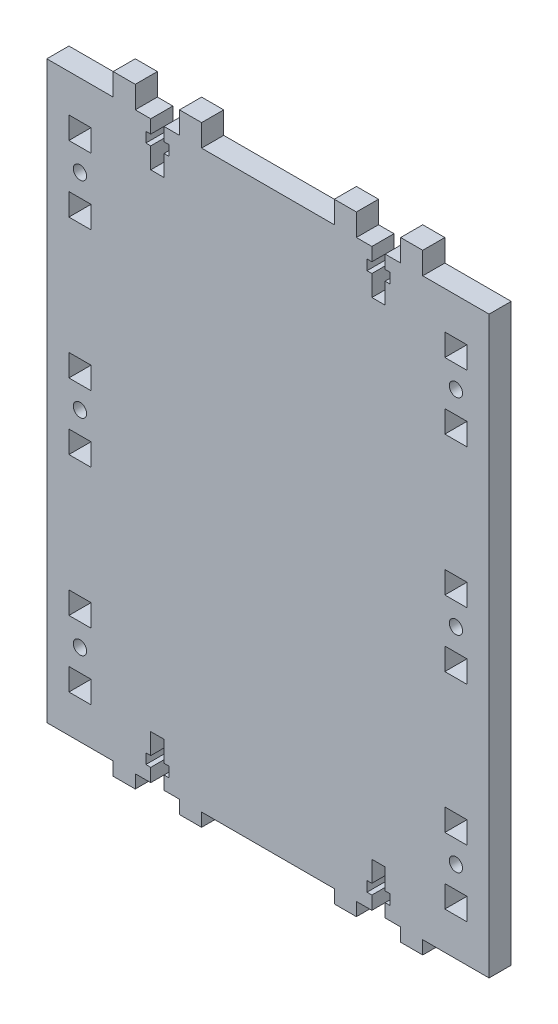
from build123d import *

# Parameters (mm, degrees)
SKETCH1_W           = 5
SKETCH1_H           = 5
SKETCH1_R           = 1.5
BOSS_EXTRUDE1_DEPTH = 5


with BuildPart() as part:
    # Sketch1 → Boss-Extrude1 (new body)
    with BuildSketch(Plane.XY):
        Polygon((-50, 65), (-50, -65), (-35, -65), (-35, -68), (-30, -68), (-30, -65), (-26.5, -65), (-26.5, -62), (-27.6, -62), (-27.6, -59.7), (-26.5, -59.7), (-26.5, -55), (-23.5, -55), (-23.5, -59.7), (-22.4, -59.7), (-22.4, -62), (-23.5, -62), (-23.5, -65), (-20, -65), (-20, -68), (-15, -68), (-15, -65), (15, -65), (15, -68), (20, -68), (20, -65), (23.5, -65), (23.5, -62), (22.4, -62), (22.4, -59.7), (23.5, -59.7), (23.5, -55), (26.5, -55), (26.5, -59.7), (27.6, -59.7), (27.6, -62), (26.5, -62), (26.5, -65), (30, -65), (30, -68), (35, -68), (35, -65), (50, -65), (50, 65), (35, 65), (35, 70), (30, 70), (30, 65), (26.5, 65), (26.5, 62), (27.6, 62), (27.6, 59.7), (26.5, 59.7), (26.5, 55), (23.5, 55), (23.5, 59.7), (22.4, 59.7), (22.4, 62), (23.5, 62), (23.5, 65), (20, 65), (20, 70), (15, 70), (15, 65), (-15, 65), (-15, 70), (-20, 70), (-20, 65), (-23.5, 65), (-23.5, 62), (-22.4, 62), (-22.4, 59.7), (-23.5, 59.7), (-23.5, 55), (-26.5, 55), (-26.5, 59.7), (-27.6, 59.7), (-27.6, 62), (-26.5, 62), (-26.5, 65), (-30, 65), (-30, 70), (-35, 70), (-35, 65), align=None)
        with Locations((-42.5, -54)):
            Rectangle(SKETCH1_W, SKETCH1_H, mode=Mode.SUBTRACT)
        with Locations((-42.5, -46.5)):
            Circle(SKETCH1_R, mode=Mode.SUBTRACT)
        with Locations((-42.5, -39)):
            Rectangle(SKETCH1_W, SKETCH1_H, mode=Mode.SUBTRACT)
        with Locations((-42.5, -7.5)):
            Rectangle(SKETCH1_W, SKETCH1_H, mode=Mode.SUBTRACT)
        with Locations((-42.5, 0)):
            Circle(SKETCH1_R, mode=Mode.SUBTRACT)
        with Locations((42.5, -54)):
            Rectangle(SKETCH1_W, SKETCH1_H, mode=Mode.SUBTRACT)
        with Locations((42.5, -46.5)):
            Circle(SKETCH1_R, mode=Mode.SUBTRACT)
        with Locations((42.5, -39)):
            Rectangle(SKETCH1_W, SKETCH1_H, mode=Mode.SUBTRACT)
        with Locations((42.5, -7.5)):
            Rectangle(SKETCH1_W, SKETCH1_H, mode=Mode.SUBTRACT)
        with Locations((42.5, 0)):
            Circle(SKETCH1_R, mode=Mode.SUBTRACT)
        with Locations((-42.5, 7.5)):
            Rectangle(SKETCH1_W, SKETCH1_H, mode=Mode.SUBTRACT)
        with Locations((-42.5, 39)):
            Rectangle(SKETCH1_W, SKETCH1_H, mode=Mode.SUBTRACT)
        with Locations((-42.5, 46.5)):
            Circle(SKETCH1_R, mode=Mode.SUBTRACT)
        with Locations((-42.5, 54)):
            Rectangle(SKETCH1_W, SKETCH1_H, mode=Mode.SUBTRACT)
        with Locations((42.5, 7.5)):
            Rectangle(SKETCH1_W, SKETCH1_H, mode=Mode.SUBTRACT)
        with Locations((42.5, 39)):
            Rectangle(SKETCH1_W, SKETCH1_H, mode=Mode.SUBTRACT)
        with Locations((42.5, 46.5)):
            Circle(SKETCH1_R, mode=Mode.SUBTRACT)
        with Locations((42.5, 54)):
            Rectangle(SKETCH1_W, SKETCH1_H, mode=Mode.SUBTRACT)
    extrude(amount=BOSS_EXTRUDE1_DEPTH)


solid = part.part
